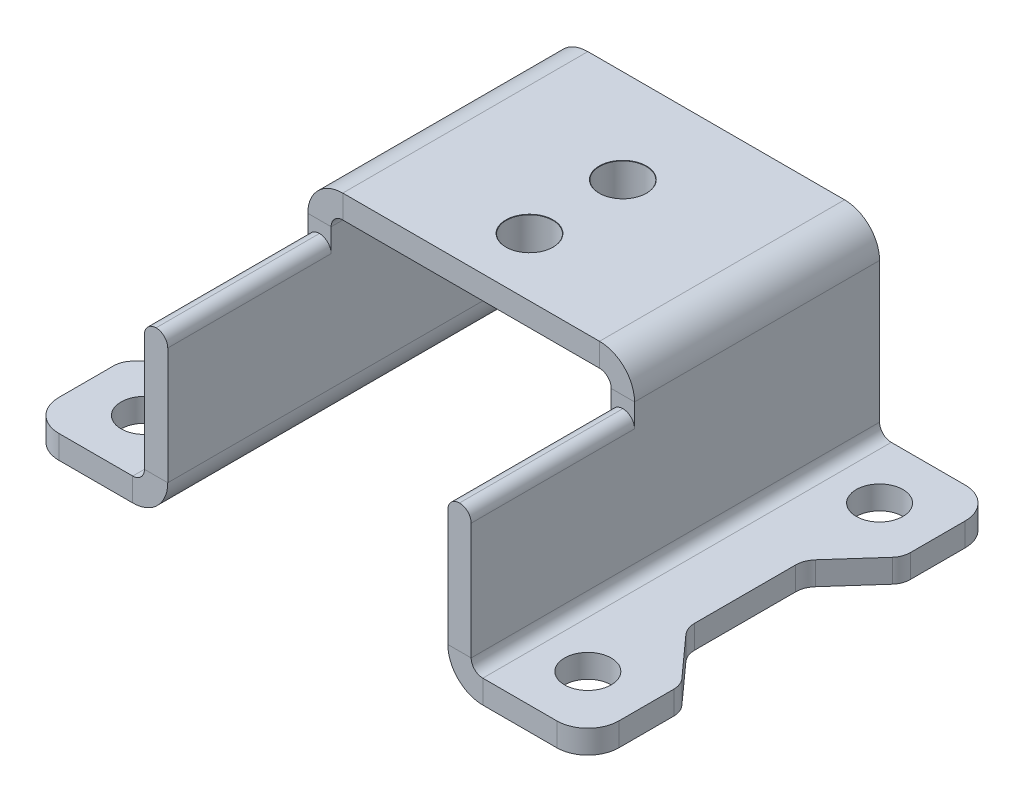
from build123d import *

# Parameters (mm, degrees)
BASE_FLANGE1_DEPTH                 = 35
SKETCH10_W                         = 28
SKETCH10_H                         = 14
CUT_EXTRUDE1_DEPTH                 = 4
F_4_0_4_DIAMETER_HOLE1_D           = 4
F_4_0_4_DIAMETER_HOLE1_CSINK_D     = 4.05
F_4_0_4_DIAMETER_HOLE1_CSINK_ANGLE = 90
SCALE1_SCALE                       = 1.5
CUT_EXTRUDE2_DEPTH                 = 10
CUT_EXTRUDE3_DEPTH                 = 10
FILLET1_R                          = 1.5


# Sheet-metal steps are written as plain solids
with BuildPart() as part:
    # Sketch1 → Base-Flange1 (new body)
    with BuildSketch(Plane.XY):
        with BuildLine():
            Line((0, 0), (-9, 0))
            ThreePointArc((-9, 0), (-11.121320344, 0.878679656), (-12, 3))
            Line((-12, 3), (-12, 15))
            ThreePointArc((-12, 15), (-12.292893219, 15.707106781), (-13, 16))
            Line((-13, 16), (-35, 16))
            ThreePointArc((-35, 16), (-35.707106781, 15.707106781), (-36, 15))
            Line((-36, 15), (-36, 3))
            ThreePointArc((-36, 3), (-36.878679656, 0.878679656), (-39, 0))
            Line((-39, 0), (-48, 0))
            Line((-48, 0), (-48, 2))
            Line((-48, 2), (-39, 2))
            ThreePointArc((-39, 2), (-38.292893219, 2.292893219), (-38, 3))
            Line((-38, 3), (-38, 15))
            ThreePointArc((-38, 15), (-37.121320344, 17.121320344), (-35, 18))
            Line((-35, 18), (-13, 18))
            ThreePointArc((-13, 18), (-10.878679656, 17.121320344), (-10, 15))
            Line((-10, 15), (-10, 3))
            ThreePointArc((-10, 3), (-9.707106781, 2.292893219), (-9, 2))
            Line((-9, 2), (0, 2))
            Line((0, 2), (0, 0))
        make_face()
    extrude(amount=-BASE_FLANGE1_DEPTH)

    # Sketch10 → Cut-Extrude1 (cut)
    with BuildSketch(Plane(origin=(0, 18, 0), x_dir=(1, 0, 0), z_dir=(0, 1, 0))):
        with Locations((-24, 7)):
            Rectangle(SKETCH10_W, SKETCH10_H)
    extrude(amount=-CUT_EXTRUDE1_DEPTH, mode=Mode.SUBTRACT)

    # Ø4.0 (4) Diameter Hole1 (through all)
    with Locations(Plane(origin=(0, 18, 0), x_dir=(1, 0, 0), z_dir=(0, 1, 0))):
        with Locations((-24, 27), (-24, 19), (-43, 30), (-43, 5), (-5, 30), (-5, 5)):
            CounterSinkHole(F_4_0_4_DIAMETER_HOLE1_D / 2, F_4_0_4_DIAMETER_HOLE1_CSINK_D / 2, counter_sink_angle=F_4_0_4_DIAMETER_HOLE1_CSINK_ANGLE)


with BuildPart() as part_1:
    # Scale1: scaled about (-24, 8.107482912, -19.478199083)
    add(part.part.scale(SCALE1_SCALE).moved(Location((12, -4.053741456, 9.739099541))))

    # Sketch15 → Cut-Extrude2 (cut)
    with BuildSketch(Plane(origin=(0, -1.053741456, 0), x_dir=(1, 0, 0), z_dir=(0, 1, 0))):
        with BuildLine():
            Line((-60, 38.767251784), (-60, 42.760900459))
            Line((-60, 42.760900459), (-56.006351326, 42.760900459))
            ThreePointArc((-56.006351326, 42.760900459), (-58.830287385, 41.591187844), (-60, 38.767251784))
        make_face()
        with BuildLine():
            Line((-60, -9.739099541), (-56.006351326, -9.739099541))
            ThreePointArc((-56.006351326, -9.739099541), (-58.830287385, -8.569386926), (-60, -5.745450867))
            Line((-60, -5.745450867), (-60, -9.739099541))
        make_face()
        with BuildLine():
            Line((12, -5.745450867), (12, -9.739099541))
            Line((12, -9.739099541), (8.006351326, -9.739099541))
            ThreePointArc((8.006351326, -9.739099541), (10.830287385, -8.569386926), (12, -5.745450867))
        make_face()
        with BuildLine():
            Line((12, 42.760900459), (8.006351326, 42.760900459))
            ThreePointArc((8.006351326, 42.760900459), (10.830287385, 41.591187844), (12, 38.767251784))
            Line((12, 38.767251784), (12, 42.760900459))
        make_face()
    extrude(amount=-CUT_EXTRUDE2_DEPTH, mode=Mode.SUBTRACT)

    # Sketch16 → Cut-Extrude3 (cut)
    with BuildSketch(Plane(origin=(0, -1.053741456, 0), x_dir=(1, 0, 0), z_dir=(0, 1, 0))):
        with BuildLine():
            Line((-54.703281617, 24.816516721), (-59.364976604, 30.038451214))
            ThreePointArc((-59.364976604, 30.038451214), (-59.835855465, 30.812399385), (-60, 31.703342281))
            Line((-60, 31.703342281), (-60, 1.311607043))
            ThreePointArc((-60, 1.311607043), (-59.839618442, 2.192620974), (-59.379051563, 2.960596195))
            Line((-59.379051563, 2.960596195), (-54.698537483, 8.165669485))
            ThreePointArc((-54.698537483, 8.165669485), (-54.186063754, 9.006077869), (-54, 9.972667676))
            Line((-54, 9.972667676), (-54, 22.972667676))
            ThreePointArc((-54, 22.972667676), (-54.181788316, 23.959377402), (-54.703281617, 24.816516721))
        make_face()
        with BuildLine():
            Line((11.364976604, 30.038451214), (6.703281617, 24.816516721))
            ThreePointArc((6.703281617, 24.816516721), (6.181788316, 23.959377402), (6, 22.972667676))
            Line((6, 22.972667676), (6, 9.972667676))
            ThreePointArc((6, 9.972667676), (6.186063754, 9.006077869), (6.698537483, 8.165669485))
            Line((6.698537483, 8.165669485), (11.379051563, 2.960596195))
            ThreePointArc((11.379051563, 2.960596195), (11.839618442, 2.192620974), (12, 1.311607043))
            Line((12, 1.311607043), (12, 31.703342281))
            ThreePointArc((12, 31.703342281), (11.835855465, 30.812399385), (11.364976604, 30.038451214))
        make_face()
    extrude(amount=-CUT_EXTRUDE3_DEPTH, mode=Mode.SUBTRACT)

    # Fillet1
    fillet1_edges = [part_1.edges().sort_by_distance(p)[0] for p in [
        (-3, 16.946258544, -0.760900459),
        (-45, 16.946258544, -0.760900458),
        (-6, 16.946258544, -0.760900459),
        (-42, 16.946258544, -0.760900459),
    ]]
    fillet(fillet1_edges, radius=FILLET1_R - 0.0001)  # a hair under: the kernel refuses the full size

    # Sketch18 → Revolve1 (revolve)
    with BuildSketch(Plane(origin=(0, 0, -30.760900459), x_dir=(-1, 0, 0), z_dir=(0, 0, -1)), mode=Mode.PRIVATE) as revolve1_sk:
        with BuildLine():
            Line((27, 19.946258544), (27, 17.298747157))
            ThreePointArc((27, 17.298747157), (27.231953871, 17.32602037), (27.451255487, 17.406352354))
            Line((27.451255487, 17.406352354), (29.130617451, 19.638600901))
            ThreePointArc((29.130617451, 19.638600901), (29.402592072, 19.865072033), (29.747074465, 19.946258544))
            Line((29.747074465, 19.946258544), (27, 19.946258544))
        make_face()
    revolve(revolve1_sk.sketch.rotate(Axis((-24, 22.908758544, -30.760900459), (0, -1, 0)), 270), axis=Axis((-24, 22.908758544, -30.760900459), (0, -1, 0)))

    # Sketch20 → Revolve2 (revolve)
    with BuildSketch(Plane(origin=(0, 0, -18.760900459), x_dir=(-1, 0, 0), z_dir=(0, 0, -1)), mode=Mode.PRIVATE) as revolve2_sk:
        with BuildLine():
            Line((29.747074465, 19.946258544), (27, 19.946258544))
            Line((27, 19.946258544), (27, 17.298747157))
            ThreePointArc((27, 17.298747157), (27.231953871, 17.32602037), (27.451255487, 17.406352354))
            Line((27.451255487, 17.406352354), (29.130617451, 19.638600901))
            ThreePointArc((29.130617451, 19.638600901), (29.402592072, 19.865072033), (29.747074465, 19.946258544))
        make_face()
    revolve(revolve2_sk.sketch.rotate(Axis((-24, 19.946258544, -18.760900459), (0, 1, 0)), 270), axis=Axis((-24, 19.946258544, -18.760900459), (0, 1, 0)))


solid = part_1.part
